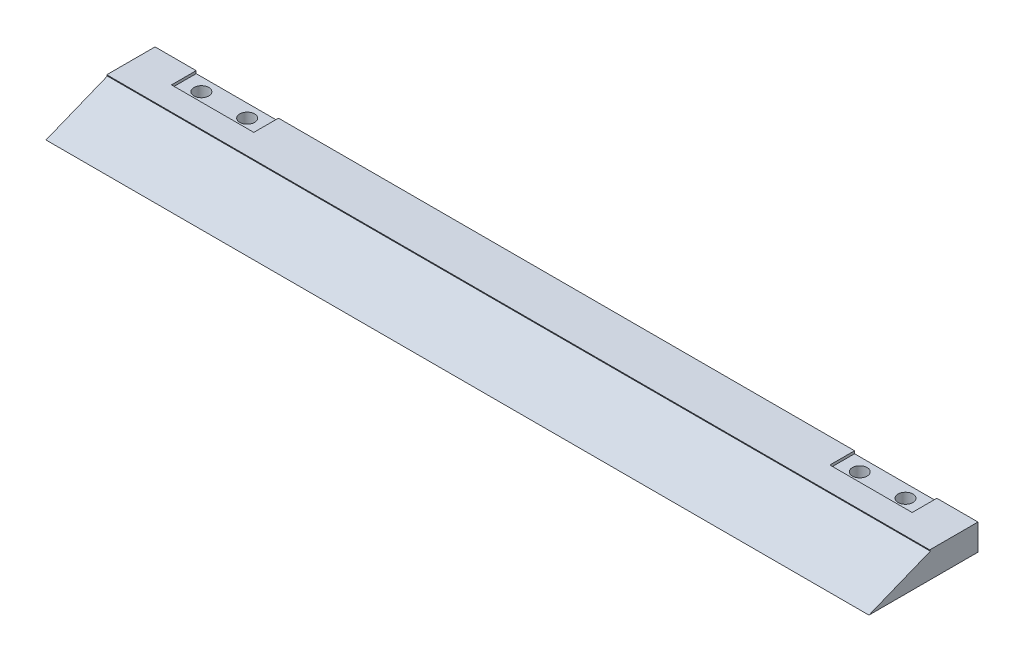
from build123d import *

# Parameters (mm, degrees)
SKETCH1_W            = 200
SKETCH1_H            = 30
BASE_DEPTH           = 6.35
WEDGECUT_REACH       = 202.662
SKETCH3_W            = 20
SKETCH3_H            = 6
HINGE_CUTOUT_DEPTH   = 0.635
HINGE_HOLE_CUT_REACH = 103.28
SKETCH4_R            = 1.8034
SKETCH5_W            = 5.05
SKETCH5_H            = 5.05
HINGE_NUT_CUT_DEPTH  = 2


with BuildPart() as part:
    # Sketch1 → Base (new body)
    with BuildSketch(Plane(origin=(0, 0, 0), x_dir=(1, 0, 0), z_dir=(0, 1, 0))):
        Rectangle(SKETCH1_W, SKETCH1_H)
    extrude(amount=BASE_DEPTH)

    # Sketch2 → WedgeCut (cut, up to next)
    with BuildSketch(Plane(origin=(100, 0, 0), x_dir=(0, 0, -1), z_dir=(1, 0, 0)), mode=Mode.PRIVATE) as wedgecut_sk1:
        Polygon((-15, 0), (-11.5, 0), (3.409035945, 6.003507268), (3.269511724, 6.35), (-15, 6.35), align=None)
    wedgecut_tool1 = extrude(wedgecut_sk1.sketch, amount=-WEDGECUT_REACH, mode=Mode.PRIVATE) & part.part
    add(wedgecut_tool1.solids().sort_by_distance((100, 3.902383, 8.426435))[0], mode=Mode.SUBTRACT)

    # Sketch3 → Hinge Cutout (cut)
    with BuildSketch(Plane(origin=(0, 6.35, 0), x_dir=(1, 0, 0), z_dir=(0, 1, 0))):
        with Locations((-80, 12)):
            Rectangle(SKETCH3_W, SKETCH3_H)
        with Locations((80, 12)):
            Rectangle(SKETCH3_W, SKETCH3_H)
    extrude(amount=-HINGE_CUTOUT_DEPTH, mode=Mode.SUBTRACT)

    # Sketch4 → Hinge Hole Cut (cut, up to next)
    with BuildSketch(Plane(origin=(0, 5.715, 0), x_dir=(1, 0, 0), z_dir=(0, 1, 0)), mode=Mode.PRIVATE) as hinge_hole_cut_sk1:
        with Locations((74.4374, 11.825)):
            Circle(SKETCH4_R)
    hinge_hole_cut_tool1 = extrude(hinge_hole_cut_sk1.sketch, amount=-HINGE_HOLE_CUT_REACH, mode=Mode.PRIVATE) & part.part
    # Sketch4 → Hinge Hole Cut (cut, up to next)
    with BuildSketch(Plane(origin=(0, 5.715, 0), x_dir=(1, 0, 0), z_dir=(0, 1, 0)), mode=Mode.PRIVATE) as hinge_hole_cut_sk2:
        with Locations((85.5626, 11.825)):
            Circle(SKETCH4_R)
    hinge_hole_cut_tool2 = extrude(hinge_hole_cut_sk2.sketch, amount=-HINGE_HOLE_CUT_REACH, mode=Mode.PRIVATE) & part.part
    hinge_hole_cut_1 = hinge_hole_cut_tool1.solids().sort_by_distance((74.4374, 5.715, -11.825))[0]
    add(hinge_hole_cut_1, mode=Mode.SUBTRACT)
    hinge_hole_cut_2 = hinge_hole_cut_tool2.solids().sort_by_distance((85.5626, 5.715, -11.825))[0]
    add(hinge_hole_cut_2, mode=Mode.SUBTRACT)
    hinge_hole_cut = hinge_hole_cut_1 + hinge_hole_cut_2  # Hinge Hole Cut as one shape, for the pattern or mirror that repeats it

    # Sketch5 → Hinge Nut Cut (cut)
    with BuildSketch(Plane.XZ):
        with Locations((74.4374, -11.825)):
            Rectangle(SKETCH5_W, SKETCH5_H)
        with Locations((85.5626, -11.825)):
            Rectangle(SKETCH5_W, SKETCH5_H)
    hinge_nut_cut = extrude(amount=-HINGE_NUT_CUT_DEPTH, mode=Mode.SUBTRACT)

    # Hinge Hole Mirror: Hinge Hole Cut, Hinge Nut Cut across plane
    add(hinge_hole_cut.mirror(Plane(origin=(0, 0, 0), x_dir=(0, 0, 1), z_dir=(1, 0, 0))), mode=Mode.SUBTRACT)
    add(hinge_nut_cut.mirror(Plane(origin=(0, 0, 0), x_dir=(0, 0, 1), z_dir=(1, 0, 0))), mode=Mode.SUBTRACT)


solid = part.part
